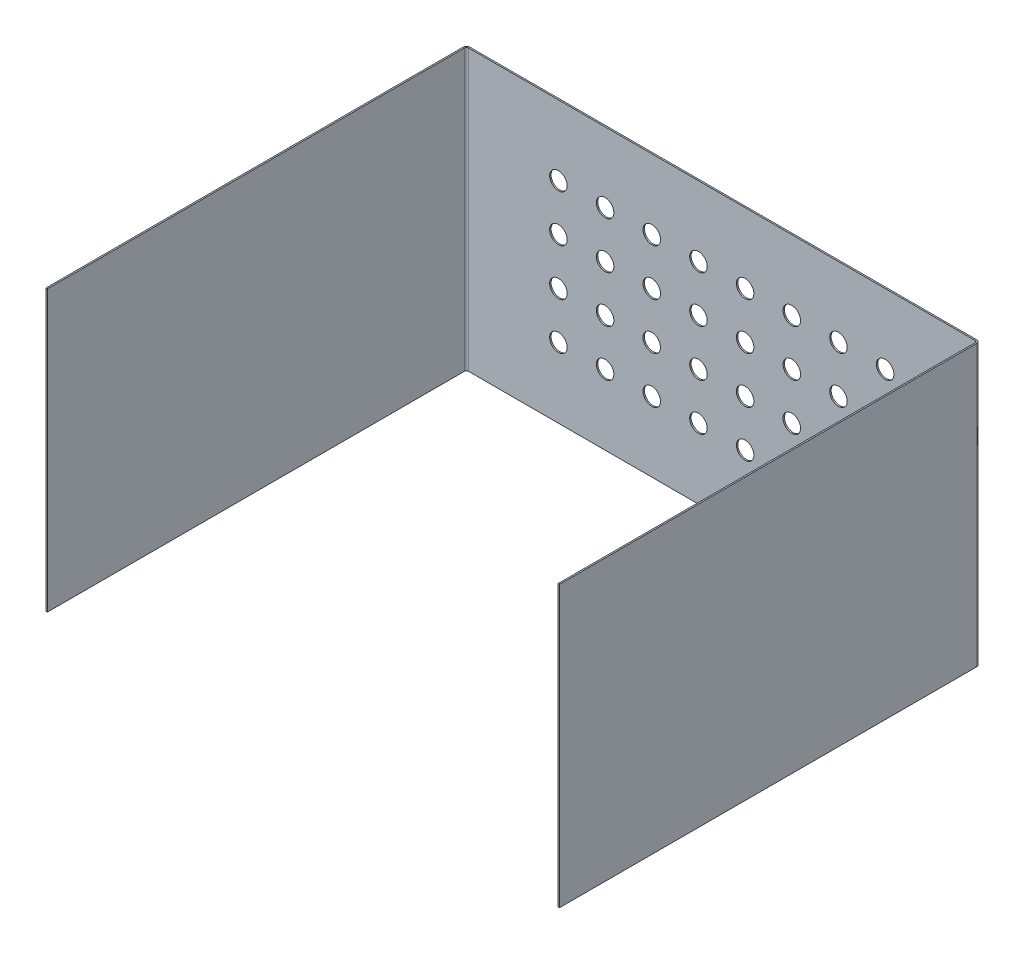
from build123d import *

# Parameters (mm, degrees)
BASE_FLANGE1_DEPTH   = 152.4
CUT_EXTRUDE1_REACH   = 393.969
SKETCH4_R            = 4.7625
LPATTERN1_COUNT      = 8
LPATTERN1_PITCH      = 25.4
LPATTERN1_COUNT_DIR2 = 4
LPATTERN1_PITCH_DIR2 = 25.4


# Sheet-metal steps are written as plain solids
with BuildPart() as part:
    # Sketch1 → Base-Flange1 (new body)
    with BuildSketch(Plane(origin=(0, 0, 0), x_dir=(1, 0, 0), z_dir=(0, 1, 0))):
        with BuildLine():
            Line((0, 0), (0, 227.04054))
            ThreePointArc((0, 227.04054), (0.515333903, 228.284666097), (1.75946, 228.8))
            Line((1.75946, 228.8), (277.64054, 228.8))
            ThreePointArc((277.64054, 228.8), (278.884666097, 228.284666097), (279.4, 227.04054))
            Line((279.4, 227.04054), (279.4, 0))
            Line((279.4, 0), (278.64054, 0))
            Line((278.64054, 0), (278.64054, 227.04054))
            ThreePointArc((278.64054, 227.04054), (278.347646781, 227.747646781), (277.64054, 228.04054))
            Line((277.64054, 228.04054), (1.75946, 228.04054))
            ThreePointArc((1.75946, 228.04054), (1.052353219, 227.747646781), (0.75946, 227.04054))
            Line((0.75946, 227.04054), (0.75946, 0))
            Line((0.75946, 0), (0, 0))
        make_face()
    extrude(amount=BASE_FLANGE1_DEPTH)

    # Sketch4 → Cut-Extrude1 (cut, up to next)
    with BuildSketch(Plane(origin=(0, 0, -228.8), x_dir=(-1, 0, 0), z_dir=(0, 0, -1)), mode=Mode.PRIVATE) as cut_extrude1_sk1:
        with Locations((-228.6, 38.1)):
            Circle(SKETCH4_R)
    cut_extrude1_tool1 = extrude(cut_extrude1_sk1.sketch, amount=-CUT_EXTRUDE1_REACH, mode=Mode.PRIVATE) & part.part
    cut_extrude1 = cut_extrude1_tool1.solids().sort_by_distance((228.6, 38.1, -228.8))[0]
    add(cut_extrude1, mode=Mode.SUBTRACT)

    # LPattern1: Cut-Extrude1 8 × 4
    with Locations(*[(-i * LPATTERN1_PITCH, j * LPATTERN1_PITCH_DIR2, 0) for i in range(LPATTERN1_COUNT) for j in range(LPATTERN1_COUNT_DIR2) if (i, j) != (0, 0)]):
        add(cut_extrude1, mode=Mode.SUBTRACT)


solid = part.part
